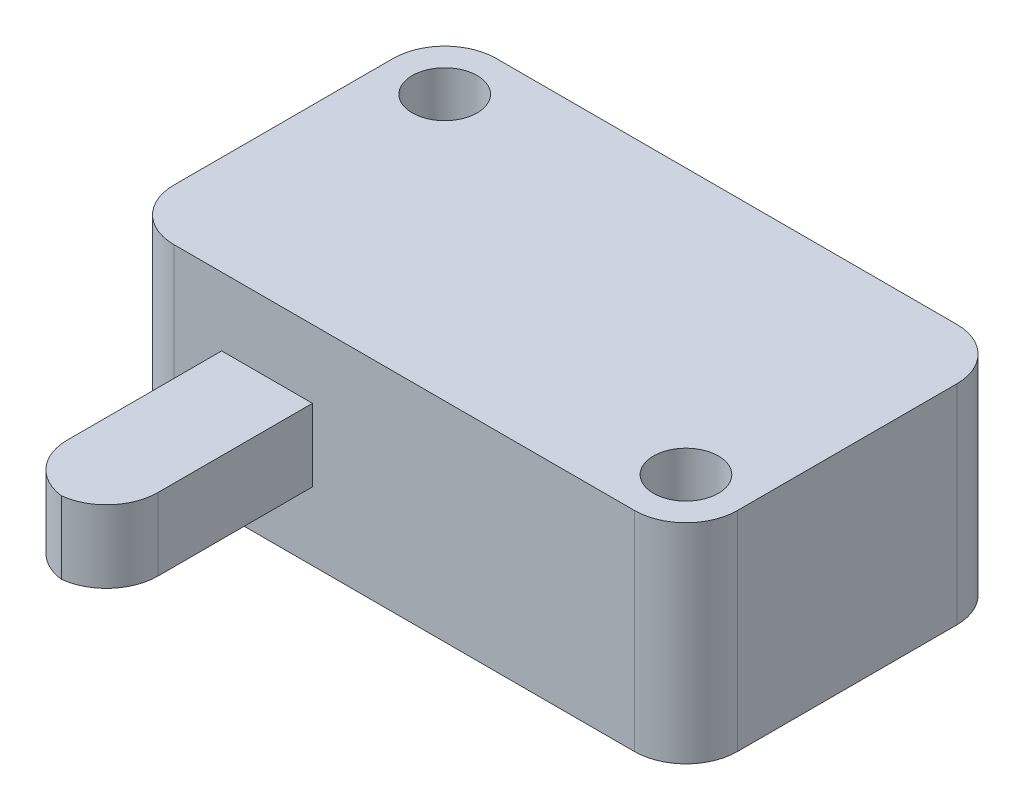
from build123d import *

# Parameters (mm, degrees)
SKETCH1_W           = 27.8
SKETCH1_H           = 15.9
BOSS_EXTRUDE1_DEPTH = 10.3
SKETCH3_R           = 1.6
CUT_EXTRUDE1_DEPTH  = 20.039498418
CIRPATTERN1_COUNT   = 2
BOSS_EXTRUDE2_DEPTH = 10.16
FILLET1_R           = 2.54
FILLET2_R           = 2.54


with BuildPart() as part:
    # Sketch1 → Boss-Extrude1 (new body)
    with BuildSketch(Plane(origin=(0, 0, 0), x_dir=(1, 0, 0), z_dir=(0, 1, 0))):
        Rectangle(SKETCH1_W, SKETCH1_H)
    extrude(amount=BOSS_EXTRUDE1_DEPTH)

    # Sketch3 → Cut-Extrude1 (cut, through all)
    with BuildSketch(Plane(origin=(0, 10.3, 0), x_dir=(1, 0, 0), z_dir=(0, 1, 0))):
        with Locations(Location((-11.1, 5.15, 0), (0, 0, 270))):
            Circle(SKETCH3_R)
    cut_extrude1 = extrude(amount=-CUT_EXTRUDE1_DEPTH, mode=Mode.SUBTRACT)

    # CirPattern1: Cut-Extrude1 ×2 about axis
    cirpattern1_axis = Axis((0, 0, 0), (0, 1, 0))
    for i in range(1, CIRPATTERN1_COUNT):
        add(cut_extrude1.rotate(cirpattern1_axis, i * 360 / CIRPATTERN1_COUNT), mode=Mode.SUBTRACT)

    # Sketch6 → Boss-Extrude2 (add)
    with BuildSketch(Plane.XY.offset(7.95)):
        Polygon((-9, 5.15), (-9, 6.935608094), (-4.523823192, 6.935608094), (-4.523823192, 3.364391906), (-9, 3.364391906), align=None)
    extrude(amount=BOSS_EXTRUDE2_DEPTH)

    # Fillet1
    fillet1_edges = [part.edges().sort_by_distance(p)[0] for p in [
        (13.9, 5.15, 7.95),
        (-13.9, 5.15, 7.95),
        (-13.9, 5.15, -7.95),
        (13.9, 5.15, -7.95),
    ]]
    fillet(fillet1_edges, radius=FILLET1_R)

    # Fillet2
    # the kernel refuses this fillet: 2.54 mm, written as the material it takes off along each edge
    with BuildSketch(Plane(origin=(-9, -2.985608094, 18.11), x_dir=(0, 0, -1), z_dir=(0, 1, 0)), Plane(origin=(-4.523823192, 13.285608094, 18.11), x_dir=(0, 0, -1), z_dir=(0, -1, 0))) as fillet2_piece_1:
        with BuildLine():
            CenterArc((FILLET2_R, -FILLET2_R), FILLET2_R, 90, 90)
            Line((0, -FILLET2_R), (0, 0))
            Line((0, 0), (FILLET2_R, 0))
        make_face()
    extrude(amount=16.271216188, mode=Mode.SUBTRACT)


solid = part.part
